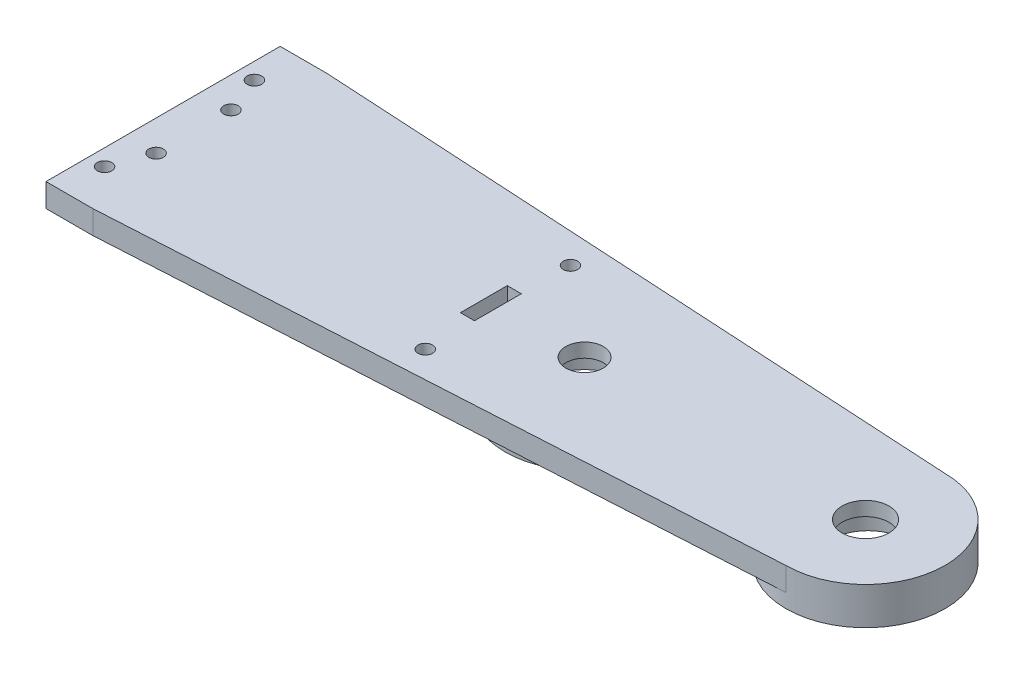
from build123d import *

# Parameters (mm, degrees)
SKETCH28_R           = 5
SKETCH28_R_2         = 4
SKETCH28_R_3         = 1.55
SKETCH28_W           = 10
SKETCH28_H           = 3
BOSS_EXTRUDE10_DEPTH = 5
SKETCH25_R           = 17
BOSS_EXTRUDE8_DEPTH  = 3
SKETCH30_R           = 17
BOSS_EXTRUDE11_DEPTH = 4
SKETCH32_R           = 9.5
CUT_EXTRUDE3_DEPTH   = 6
SKETCH33_R           = 8
CUT_EXTRUDE4_DEPTH   = 5


with BuildPart() as part:
    # Sketch28 → Boss-Extrude10 (new body)
    with BuildSketch(Plane(origin=(-32, 0, 0), x_dir=(0, 0, 1), z_dir=(0, -1, 0))):
        with BuildLine():
            Line((-25, 15), (25, 15))
            Line((25, 15), (25, 5))
            Line((25, 5), (17, -135))
            ThreePointArc((17, -135), (0, -152), (-17, -135))
            Line((-17, -135), (-25, 5))
            Line((-25, 5), (-25, 15))
        make_face()
        with Locations((0, -135)):
            Circle(SKETCH28_R, mode=Mode.SUBTRACT)
        with Locations((0, -75)):
            Circle(SKETCH28_R_2, mode=Mode.SUBTRACT)
        with Locations((8, 8.5)):
            Circle(SKETCH28_R_3, mode=Mode.SUBTRACT)
        with Locations((-8, 8.5)):
            Circle(SKETCH28_R_3, mode=Mode.SUBTRACT)
        with Locations((16, 11.5)):
            Circle(SKETCH28_R_3, mode=Mode.SUBTRACT)
        with Locations((-16, 11.5)):
            Circle(SKETCH28_R_3, mode=Mode.SUBTRACT)
        with Locations((-15.5, -56.5)):
            Circle(SKETCH28_R_3, mode=Mode.SUBTRACT)
        with Locations((15.5, -56.5)):
            Circle(SKETCH28_R_3, mode=Mode.SUBTRACT)
        with Locations((0, -55)):
            Rectangle(SKETCH28_W, SKETCH28_H, mode=Mode.SUBTRACT)
    extrude(amount=BOSS_EXTRUDE10_DEPTH)

    # Sketch25 → Boss-Extrude8 (add)
    with BuildSketch(Plane(origin=(0, -5, 0), x_dir=(0, 0, 1), z_dir=(0, -1, 0))):
        with Locations((0, -103)):
            Circle(SKETCH25_R)
    extrude(amount=BOSS_EXTRUDE8_DEPTH)

    # Sketch30 → Boss-Extrude11 (add)
    with BuildSketch(Plane(origin=(0, -5, 0), x_dir=(0, 0, 1), z_dir=(0, -1, 0))):
        with Locations((0, -43)):
            Circle(SKETCH30_R)
    extrude(amount=BOSS_EXTRUDE11_DEPTH)

    # Sketch32 → Cut-Extrude3 (cut)
    with BuildSketch(Plane.XZ.offset(9)):
        with Locations((43, 0)):
            Circle(SKETCH32_R)
    extrude(amount=-CUT_EXTRUDE3_DEPTH, mode=Mode.SUBTRACT)

    # Sketch33 → Cut-Extrude4 (cut)
    with BuildSketch(Plane.XZ.offset(8)):
        with Locations((103, -0.549344368)):
            Circle(SKETCH33_R)
    extrude(amount=-CUT_EXTRUDE4_DEPTH, mode=Mode.SUBTRACT)


solid = part.part
